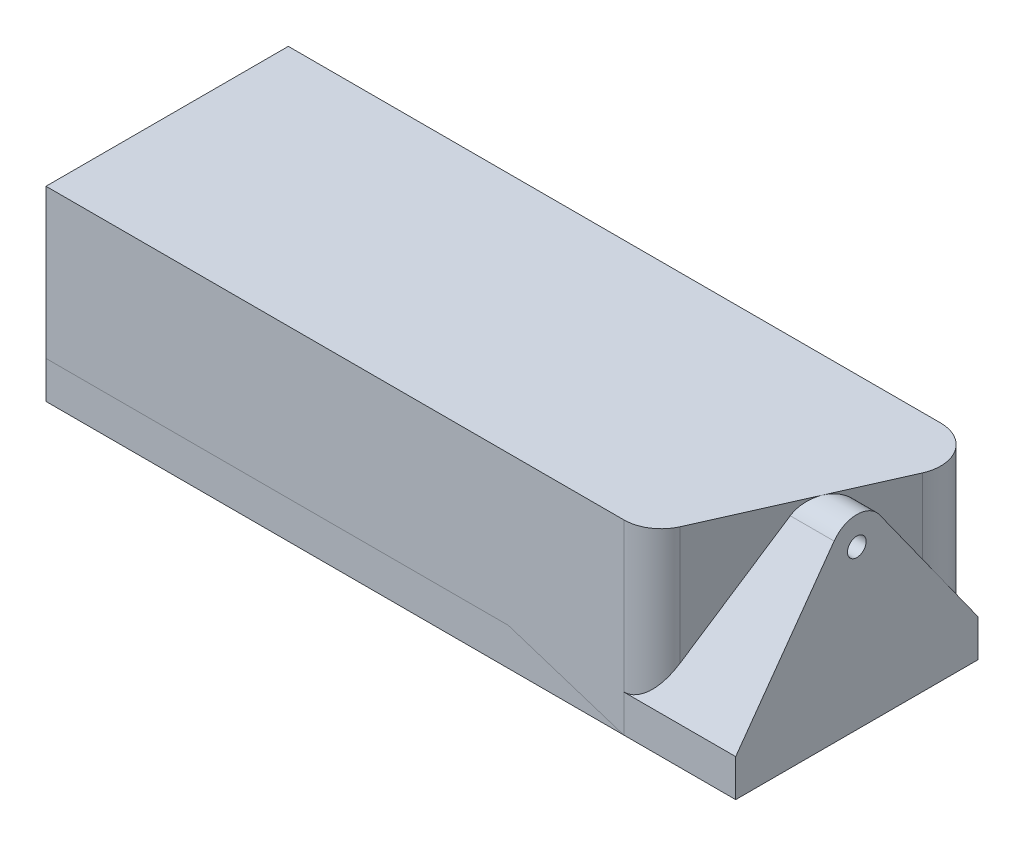
from build123d import *

# Parameters (mm, degrees)
BOSS_EXTRUDE1_DEPTH      = 15.875
BOSS_EXTRUDE2_DEPTH      = 10.31875
BOSS_EXTRUDE2_DEPTH_BACK = 10.31875
SKETCH3_R                = 0.79375
BOSS_EXTRUDE3_DEPTH      = 58.7375


with BuildPart() as part:
    # Sketch1 → Boss-Extrude1 (new body)
    with BuildSketch(Plane(origin=(0, 0, 0), x_dir=(1, 0, 0), z_dir=(0, 1, 0))):
        with BuildLine():
            Line((0, -10.31875), (0, 10.31875))
            Line((0, 10.31875), (55.5625, 10.31875))
            ThreePointArc((55.5625, 10.31875), (58.224712855, 8.873850492), (58.463851667, 5.85426037))
            Line((58.463851667, 5.85426037), (52.113851667, -8.43323963))
            ThreePointArc((52.113851667, -8.43323963), (50.942600492, -9.805962855), (49.2125, -10.31875))
            Line((49.2125, -10.31875), (0, -10.31875))
        make_face()
    extrude(amount=BOSS_EXTRUDE1_DEPTH)


with BuildPart() as body_2:
    # Sketch2 → Boss-Extrude2 (new, two sides: drawn at the far end of the back side and taken through both)
    with BuildSketch(Plane.XY.offset(-BOSS_EXTRUDE2_DEPTH_BACK)):
        Polygon((0, 0), (0, 3.175), (1.5875, 3.175), (1.5875, 15.875), (3.96875, 15.875), (3.96875, 3.175), (7.14375, 3.175), (7.14375, 15.875), (9.525, 15.875), (9.525, 3.175), (28.575, 3.175), (28.575, 0), align=None)
    extrude(amount=BOSS_EXTRUDE2_DEPTH + BOSS_EXTRUDE2_DEPTH_BACK)


with BuildPart() as body_3:
    # Sketch3 → Boss-Extrude3 (new body)
    with BuildSketch(Plane(origin=(0, 0, 0), x_dir=(0, 0, -1), z_dir=(1, 0, 0))):
        with BuildLine():
            Line((10.31875, 0), (-10.31875, 0))
            Line((-10.31875, 0), (-10.31875, 3.175))
            Line((-10.31875, 3.175), (-1.93598896, 14.880219729))
            ThreePointArc((-1.93598896, 14.880219729), (0, 15.875), (1.93598896, 14.880219729))
            Line((1.93598896, 14.880219729), (10.31875, 3.175))
            Line((10.31875, 3.175), (10.31875, 0))
        make_face()
        with Locations((0, 13.49375)):
            Circle(SKETCH3_R, mode=Mode.SUBTRACT)
    extrude(amount=BOSS_EXTRUDE3_DEPTH)


solid = Compound([part.part, body_2.part, body_3.part])
